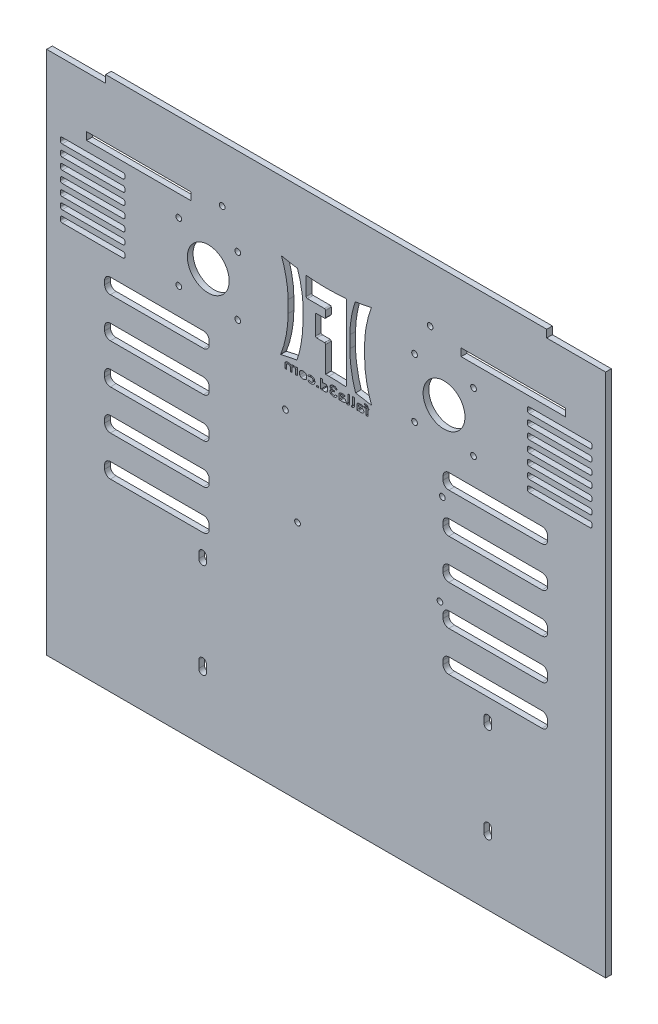
from build123d import *

# Parameters (mm, degrees)
SKETCH1_R           = 1.5
SKETCH1_W           = 0.92247458
SKETCH1_H           = 0.720885655
SKETCH1_R_2         = 11
SKETCH1_W_2         = 55
SKETCH1_H_2         = 4
BOSS_EXTRUDE1_DEPTH = 3


with BuildPart() as part:
    # Sketch1 → Boss-Extrude1 (new body)
    with BuildSketch(Plane.XY):
        Polygon((-147, -122), (147, -122), (147, 154), (116, 154), (116, 158), (-116, 158), (-116, 154), (-147, 154), align=None)
        with BuildLine():
            ThreePointArc((-63, -88), (-65, -90), (-67, -88))
            Line((-67, -88), (-67, -84.07834269))
            ThreePointArc((-67, -84.07834269), (-65, -82.07834269), (-63, -84.07834269))
            Line((-63, -84.07834269), (-63, -88))
        make_face(mode=Mode.SUBTRACT)
        with BuildLine():
            ThreePointArc((-64.5, -17), (-62.378679656, -17.878679656), (-61.5, -20))
            Line((-61.5, -20), (-61.5, -22))
            ThreePointArc((-61.5, -22), (-62.378679656, -24.121320344), (-64.5, -25))
            Line((-64.5, -25), (-113.5, -25))
            ThreePointArc((-113.5, -25), (-115.621320344, -24.121320344), (-116.5, -22))
            Line((-116.5, -22), (-116.5, -20))
            ThreePointArc((-116.5, -20), (-115.621320344, -17.878679656), (-113.5, -17))
            Line((-113.5, -17), (-64.5, -17))
        make_face(mode=Mode.SUBTRACT)
        with BuildLine():
            ThreePointArc((-64.5, 4), (-62.378679656, 3.121320344), (-61.5, 1))
            Line((-61.5, 1), (-61.5, -1))
            ThreePointArc((-61.5, -1), (-62.378679656, -3.121320344), (-64.5, -4))
            Line((-64.5, -4), (-113.5, -4))
            ThreePointArc((-113.5, -4), (-115.621320344, -3.121320344), (-116.5, -1))
            Line((-116.5, -1), (-116.5, 1))
            ThreePointArc((-116.5, 1), (-115.621320344, 3.121320344), (-113.5, 4))
            Line((-113.5, 4), (-64.5, 4))
        make_face(mode=Mode.SUBTRACT)
        with BuildLine():
            ThreePointArc((-63, -38), (-65, -40), (-67, -38))
            Line((-67, -38), (-67, -35.07834269))
            ThreePointArc((-67, -35.07834269), (-65, -33.07834269), (-63, -35.07834269))
            Line((-63, -35.07834269), (-63, -38))
        make_face(mode=Mode.SUBTRACT)
        with Locations((-15.065051974, 4.435129713)):
            Circle(SKETCH1_R, mode=Mode.SUBTRACT)
        with BuildLine():
            ThreePointArc((87, -88), (85, -90), (83, -88))
            Line((83, -88), (83, -84.07834269))
            ThreePointArc((83, -84.07834269), (85, -82.07834269), (87, -84.07834269))
            Line((87, -84.07834269), (87, -88))
        make_face(mode=Mode.SUBTRACT)
        with Locations((59.849932509, 5.935129713)):
            Circle(SKETCH1_R, mode=Mode.SUBTRACT)
        with BuildLine():
            ThreePointArc((87, -38), (85, -40), (83, -38))
            Line((83, -38), (83, -35.07834269))
            ThreePointArc((83, -35.07834269), (85, -33.07834269), (87, -35.07834269))
            Line((87, -35.07834269), (87, -38))
        make_face(mode=Mode.SUBTRACT)
        with BuildLine():
            Line((64.5, -17), (113.5, -17))
            ThreePointArc((113.5, -17), (115.621320344, -17.878679656), (116.5, -20))
            Line((116.5, -20), (116.5, -22))
            ThreePointArc((116.5, -22), (115.621320344, -24.121320344), (113.5, -25))
            Line((113.5, -25), (64.5, -25))
            ThreePointArc((64.5, -25), (62.378679656, -24.121320344), (61.5, -22))
            Line((61.5, -22), (61.5, -20))
            ThreePointArc((61.5, -20), (62.378679656, -17.878679656), (64.5, -17))
        make_face(mode=Mode.SUBTRACT)
        with BuildLine():
            Line((64.5, 4), (113.5, 4))
            ThreePointArc((113.5, 4), (115.621320344, 3.121320344), (116.5, 1))
            Line((116.5, 1), (116.5, -1))
            ThreePointArc((116.5, -1), (115.621320344, -3.121320344), (113.5, -4))
            Line((113.5, -4), (64.5, -4))
            ThreePointArc((64.5, -4), (62.378679656, -3.121320344), (61.5, -1))
            Line((61.5, -1), (61.5, 1))
            ThreePointArc((61.5, 1), (62.378679656, 3.121320344), (64.5, 4))
        make_face(mode=Mode.SUBTRACT)
        with BuildLine():
            ThreePointArc((-64.5, 25), (-62.378679656, 24.121320344), (-61.5, 22))
            Line((-61.5, 22), (-61.5, 20))
            ThreePointArc((-61.5, 20), (-62.378679656, 17.878679656), (-64.5, 17))
            Line((-64.5, 17), (-113.5, 17))
            ThreePointArc((-113.5, 17), (-115.621320344, 17.878679656), (-116.5, 20))
            Line((-116.5, 20), (-116.5, 22))
            ThreePointArc((-116.5, 22), (-115.621320344, 24.121320344), (-113.5, 25))
            Line((-113.5, 25), (-64.5, 25))
        make_face(mode=Mode.SUBTRACT)
        with BuildLine():
            ThreePointArc((-64.5, 46), (-62.378679656, 45.121320344), (-61.5, 43))
            Line((-61.5, 43), (-61.5, 41))
            ThreePointArc((-61.5, 41), (-62.378679656, 38.878679656), (-64.5, 38))
            Line((-64.5, 38), (-113.5, 38))
            ThreePointArc((-113.5, 38), (-115.621320344, 38.878679656), (-116.5, 41))
            Line((-116.5, 41), (-116.5, 43))
            ThreePointArc((-116.5, 43), (-115.621320344, 45.121320344), (-113.5, 46))
            Line((-113.5, 46), (-64.5, 46))
        make_face(mode=Mode.SUBTRACT)
        with BuildLine():
            ThreePointArc((-106.82550191, 82), (-106.118395129, 81.707106781), (-105.82550191, 81))
            Line((-105.82550191, 81), (-105.82550191, 80))
            ThreePointArc((-105.82550191, 80), (-106.118395129, 79.292893219), (-106.82550191, 79))
            Line((-106.82550191, 79), (-138.82550191, 79))
            ThreePointArc((-138.82550191, 79), (-139.532608691, 79.292893219), (-139.82550191, 80))
            Line((-139.82550191, 80), (-139.82550191, 81))
            ThreePointArc((-139.82550191, 81), (-139.532608691, 81.707106781), (-138.82550191, 82))
            Line((-138.82550191, 82), (-106.82550191, 82))
        make_face(mode=Mode.SUBTRACT)
        with BuildLine():
            ThreePointArc((-106.82550191, 88), (-106.118395129, 87.707106781), (-105.82550191, 87))
            Line((-105.82550191, 87), (-105.82550191, 86))
            ThreePointArc((-105.82550191, 86), (-106.118395129, 85.292893219), (-106.82550191, 85))
            Line((-106.82550191, 85), (-138.82550191, 85))
            ThreePointArc((-138.82550191, 85), (-139.532608691, 85.292893219), (-139.82550191, 86))
            Line((-139.82550191, 86), (-139.82550191, 87))
            ThreePointArc((-139.82550191, 87), (-139.532608691, 87.707106781), (-138.82550191, 88))
            Line((-138.82550191, 88), (-106.82550191, 88))
        make_face(mode=Mode.SUBTRACT)
        with BuildLine():
            ThreePointArc((-64.5, 67), (-62.378679656, 66.121320344), (-61.5, 64))
            Line((-61.5, 64), (-61.5, 62))
            ThreePointArc((-61.5, 62), (-62.378679656, 59.878679656), (-64.5, 59))
            Line((-64.5, 59), (-113.5, 59))
            ThreePointArc((-113.5, 59), (-115.621320344, 59.878679656), (-116.5, 62))
            Line((-116.5, 62), (-116.5, 64))
            ThreePointArc((-116.5, 64), (-115.621320344, 66.121320344), (-113.5, 67))
            Line((-113.5, 67), (-64.5, 67))
        make_face(mode=Mode.SUBTRACT)
        with Locations((-77.5, 81)):
            Circle(SKETCH1_R, mode=Mode.SUBTRACT)
        with Locations((-21.415051974, 52.695129713)):
            Circle(SKETCH1_R, mode=Mode.SUBTRACT)
        with Locations((-46.5, 81)):
            Circle(SKETCH1_R, mode=Mode.SUBTRACT)
        with BuildLine():
            Line((-15.097197603, 74.863458066), (-15.097197603, 71.264505587))
            Line((-15.097197603, 71.264505587), (-16.020593606, 71.264505587))
            Line((-16.020593606, 71.264505587), (-16.020593606, 73.40990721))
            add(Edge.make_bspline(
                [(-16.299727456, 73.986371111), (-16.113569226, 73.854425138), (-16.020593606, 73.662207781), (-16.020593606, 73.40990721)],
                knots=[22, 22, 22, 22, 23, 23, 23, 23], degree=3))
            add(Edge.make_bspline(
                [(-16.983505658, 74.187771246), (-16.704371808, 74.187771246), (-16.476326565, 74.120518692), (-16.299727456, 73.986371111)],
                knots=[21, 21, 21, 21, 22, 22, 22, 22], degree=3))
            add(Edge.make_bspline(
                [(-17.671875249, 73.986371111), (-17.491964319, 74.120518692), (-17.262451337, 74.187771246), (-16.983505658, 74.187771246)],
                knots=[20, 20, 20, 20, 21, 21, 21, 21], degree=3))
            add(Edge.make_bspline(
                [(-17.937046762, 73.40990721), (-17.937046762, 73.662207781), (-17.848474358, 73.854425138), (-17.671875249, 73.986371111)],
                knots=[19, 19, 19, 19, 20, 20, 20, 20], degree=3))
            Line((-17.937046762, 73.40990721), (-17.937046762, 71.264505587))
            Line((-17.937046762, 71.264505587), (-18.859520723, 71.264505587))
            Line((-18.859520723, 71.264505587), (-18.859520723, 73.40990721))
            add(Edge.make_bspline(
                [(-19.134063185, 73.986371111), (-18.951028604, 73.854425138), (-18.859520723, 73.662207781), (-18.859520723, 73.40990721)],
                knots=[15, 15, 15, 15, 16, 16, 16, 16], degree=3))
            add(Edge.make_bspline(
                [(-19.822432775, 74.187771245), (-19.543298925, 74.187771245), (-19.313955298, 74.120518692), (-19.134063185, 73.986371111)],
                knots=[14, 14, 14, 14, 15, 15, 15, 15], degree=3))
            add(Edge.make_bspline(
                [(-20.506210978, 73.986371111), (-20.329423697, 74.120518692), (-20.101566626, 74.187771245), (-19.822432775, 74.187771245)],
                knots=[13, 13, 13, 13, 14, 14, 14, 14], degree=3))
            add(Edge.make_bspline(
                [(-20.77138249, 73.40990721), (-20.77138249, 73.662207781), (-20.682979441, 73.854425138), (-20.506210978, 73.986371111)],
                knots=[12, 12, 12, 12, 13, 13, 13, 13], degree=3))
            Line((-20.77138249, 73.40990721), (-20.77138249, 71.264505587))
            Line((-20.77138249, 71.264505587), (-21.694778493, 71.264505587))
            Line((-21.694778493, 71.264505587), (-21.694778493, 73.656882522))
            add(Edge.make_bspline(
                [(-21.191814445, 74.592961295), (-21.515055734, 74.380364946), (-21.68264142, 74.068319871), (-21.694778493, 73.656882522)],
                knots=[8, 8, 8, 8, 9, 9, 9, 9], degree=3))
            add(Edge.make_bspline(
                [(-20.112951011, 74.908487546), (-20.506022806, 74.908487546), (-20.86582585, 74.803374853), (-21.191814445, 74.592961295)],
                knots=[7, 7, 7, 7, 8, 8, 8, 8], degree=3))
            add(Edge.make_bspline(
                [(-18.617870669, 74.436948166), (-18.989622613, 74.755955593), (-19.487995272, 74.913078934), (-20.112951011, 74.908487546)],
                knots=[6, 6, 6, 6, 7, 7, 7, 7], degree=3))
            add(Edge.make_bspline(
                [(-18.073753477, 74.780229738), (-18.271860608, 74.690170778), (-18.45322046, 74.575687136), (-18.617870669, 74.436948166)],
                knots=[5, 5, 5, 5, 6, 6, 6, 6], degree=3))
            add(Edge.make_bspline(
                [(-17.278257757, 74.908487546), (-17.607370002, 74.903896157), (-17.872541514, 74.861068286), (-18.073753477, 74.780229738)],
                knots=[4, 4, 4, 4, 5, 5, 5, 5], degree=3))
            add(Edge.make_bspline(
                [(-16.039147332, 74.482165818), (-16.353205844, 74.766436755), (-16.766110932, 74.908487546), (-17.278257757, 74.908487546)],
                knots=[3, 3, 3, 3, 4, 4, 4, 4], degree=3))
            Line((-16.039147332, 74.482165818), (-16.021515647, 74.482165818))
            Line((-16.021515647, 74.482165818), (-16.021515647, 74.863458066))
            Line((-16.021515647, 74.863458066), (-15.097197603, 74.863458066))
        make_face(mode=Mode.SUBTRACT)
        with BuildLine():
            add(Edge.make_bspline(
                [(-10.344207595, 73.942828187), (-10.264441627, 73.739019455), (-10.224568052, 73.447221652), (-10.224568052, 72.688287686), (-10.264441627, 72.399406543), (-10.344207595, 72.20058436)],
                knots=[0, 0, 0, 0, 1, 1, 1.998018429, 1.998018429, 1.998018429, 1.998018429], degree=3))
            add(Edge.make_bspline(
                [(-10.724765489, 71.684015501), (-10.553699106, 71.829566285), (-10.426720868, 72.00174336), (-10.344207595, 72.20058436)],
                knots=[15, 15, 15, 15, 16, 16, 16, 16], degree=3))
            add(Edge.make_bspline(
                [(-11.256030556, 71.37898923), (-11.028719182, 71.469029372), (-10.85174373, 71.570830244), (-10.724765489, 71.684015501)],
                knots=[14, 14, 14, 14, 15, 15, 15, 15], degree=3))
            add(Edge.make_bspline(
                [(-12.119155173, 71.222976101), (-11.767989209, 71.227567489), (-11.480218279, 71.279559321), (-11.256030556, 71.37898923)],
                knots=[13, 13, 13, 13, 14, 14, 14, 14], degree=3))
            add(Edge.make_bspline(
                [(-12.999930293, 71.37898923), (-12.775742569, 71.279559321), (-12.482081867, 71.227567489), (-12.119155173, 71.222976101)],
                knots=[12, 12, 12, 12, 13, 13, 13, 13], degree=3))
            add(Edge.make_bspline(
                [(-13.296507657, 71.528002372), (-13.219884154, 71.470120768), (-13.121018761, 71.420518716), (-12.999930293, 71.37898923)],
                knots=[11, 11, 11, 11, 12, 12, 12, 12], degree=3))
            add(Edge.make_bspline(
                [(-13.513544857, 71.684015501), (-13.454364868, 71.630913457), (-13.382144582, 71.578921625), (-13.296507657, 71.528002372)],
                knots=[10, 10, 10, 10, 11, 11, 11, 11], degree=3))
            add(Edge.make_bspline(
                [(-13.903116659, 72.20058436), (-13.826304984, 72.00174336), (-13.696372448, 71.829566285), (-13.513544857, 71.684015501)],
                knots=[9, 9, 9, 9, 10, 10, 10, 10], degree=3))
            add(Edge.make_bspline(
                [(-13.903286013, 73.941172277), (-13.976974038, 73.737739888), (-14.013742781, 73.446487782), (-14.013742781, 73.067378325), (-14.013742781, 72.688287686), (-13.976804683, 72.399406543), (-13.903116659, 72.20058436)],
                knots=[7, 7, 7, 7, 8, 8, 8, 9, 9, 9, 9], degree=3))
            add(Edge.make_bspline(
                [(-13.514824425, 74.443929335), (-13.69729449, 74.307580146), (-13.82666251, 74.139994459), (-13.903286013, 73.941172277)],
                knots=[6, 6, 6, 6, 7, 7, 7, 7], degree=3))
            add(Edge.make_bspline(
                [(-13.001209861, 74.766436755), (-13.222650278, 74.671617052), (-13.39371714, 74.564114579), (-13.514824425, 74.443929335)],
                knots=[5, 5, 5, 5, 6, 6, 6, 6], degree=3))
            add(Edge.make_bspline(
                [(-12.119889043, 74.908487546), (-12.483003908, 74.903896157), (-12.776833965, 74.856476897), (-13.001209861, 74.766436755)],
                knots=[4, 4, 4, 4, 5, 5, 5, 5], degree=3))
            add(Edge.make_bspline(
                [(-11.256388082, 74.767170624), (-11.480763977, 74.856853241), (-11.768723079, 74.903896157), (-12.119889043, 74.908487546)],
                knots=[3, 3, 3, 3, 4, 4, 4, 4], degree=3))
            add(Edge.make_bspline(
                [(-10.724953661, 74.446319116), (-10.851931902, 74.565958661), (-11.029076709, 74.672896619), (-11.256388082, 74.767170624)],
                knots=[2, 2, 2, 2, 3, 3, 3, 3], degree=3))
            add(Edge.make_bspline(
                [(-10.344207595, 73.942828187), (-10.426890223, 74.141838542), (-10.55386846, 74.309800572), (-10.724953661, 74.446319116)],
                knots=[1, 1, 1, 1, 2, 2, 2, 2], degree=3))
        make_face(mode=Mode.SUBTRACT)
        with BuildLine():
            Line((-9.680450875, 71.843716795), (-8.998159246, 72.319471219))
            add(Edge.make_bspline(
                [(-8.063905762, 71.943673584), (-8.453477553, 71.948264973), (-8.764958105, 72.07360612), (-8.998159246, 72.319471219)],
                knots=[12, 12, 12, 12, 13, 13, 13, 13], degree=3))
            add(Edge.make_bspline(
                [(-6.868168936, 73.060585329), (-6.880117837, 72.304398669), (-7.278514879, 71.932101027), (-8.063905762, 71.943673584)],
                knots=[11, 11, 11, 11, 12, 12, 12, 12], degree=3))
            add(Edge.make_bspline(
                [(-8.063905762, 74.187771246), (-7.278703051, 74.196954023), (-6.880117837, 73.821175205), (-6.868168936, 73.060585329)],
                knots=[10, 10, 10, 10, 11, 11, 11, 11], degree=3))
            add(Edge.make_bspline(
                [(-8.9983286, 73.808492435), (-8.765146277, 74.051967754), (-8.453665725, 74.178400297), (-8.063905762, 74.187771246)],
                knots=[9, 9, 9, 9, 10, 10, 10, 10], degree=3))
            Line((-8.9983286, 73.808492435), (-9.680450875, 74.282402777))
            add(Edge.make_bspline(
                [(-8.972416844, 74.735557785), (-9.243836168, 74.622560699), (-9.479784614, 74.471496485), (-9.680450875, 74.282402777)],
                knots=[7, 7, 7, 7, 8, 8, 8, 8], degree=3))
            add(Edge.make_bspline(
                [(-8.029733788, 74.908487546), (-8.386770699, 74.903896158), (-8.700829203, 74.846183907), (-8.972416844, 74.735557785)],
                knots=[6, 6, 6, 6, 7, 7, 7, 7], degree=3))
            add(Edge.make_bspline(
                [(-6.600607651, 74.482165818), (-7.010596067, 74.771028144), (-7.48708435, 74.913078935), (-8.029733788, 74.908487546)],
                knots=[5, 5, 5, 5, 6, 6, 6, 6], degree=3))
            add(Edge.make_bspline(
                [(-5.945694999, 73.060585329), (-5.957455727, 73.714594773), (-6.175753672, 74.188505115), (-6.600607651, 74.482165818)],
                knots=[4, 4, 4, 4, 5, 5, 5, 5], degree=3))
            add(Edge.make_bspline(
                [(-6.599873781, 71.656278998), (-6.175584318, 71.945141323), (-5.957455727, 72.413368881), (-5.945694999, 73.060585329)],
                knots=[3, 3, 3, 3, 4, 4, 4, 4], degree=3))
            add(Edge.make_bspline(
                [(-8.028077877, 71.222976101), (-7.485785965, 71.222976101), (-7.009674026, 71.367397855), (-6.599873781, 71.656278998)],
                knots=[2, 2, 2, 2, 3, 3, 3, 3], degree=3))
            add(Edge.make_bspline(
                [(-8.971514138, 71.405634338), (-8.699907162, 71.288384572), (-8.38530296, 71.22756749), (-8.028077877, 71.222976101)],
                knots=[1, 1, 1, 1, 2, 2, 2, 2], degree=3))
            add(Edge.make_bspline(
                [(-9.680450875, 71.843716795), (-9.47961526, 71.664370379), (-9.24329047, 71.518273897), (-8.971514138, 71.405634338)],
                knots=[0, 0, 0, 0, 1, 1, 1, 1], degree=3))
        make_face(mode=Mode.SUBTRACT)
        with Locations((-4.541755317, 71.624948416)):
            Rectangle(SKETCH1_W, SKETCH1_H, mode=Mode.SUBTRACT)
        with BuildLine():
            Line((-1.94089397, 71.640284406), (-1.94089397, 71.264505588))
            Line((-1.94089397, 71.264505588), (-2.86355608, 71.264505588))
            Line((-2.86355608, 71.264505588), (-2.86355608, 76.319775046))
            Line((-2.86355608, 76.319775046), (-1.940893971, 76.319775046))
            Line((-1.940893971, 76.319775046), (-1.940893971, 74.484367427))
            add(Edge.make_bspline(
                [(-1.405489141, 74.794737774), (-1.591365109, 74.714256752), (-1.769808296, 74.61079997), (-1.940893971, 74.484367427)],
                knots=[9, 9, 9, 9, 10, 10, 10, 10], degree=3))
            add(Edge.make_bspline(
                [(-0.750670575, 74.908487547), (-0.986713108, 74.908487547), (-1.204916967, 74.870627407), (-1.405489141, 74.794737774)],
                knots=[8, 8, 8, 8, 9, 9, 9, 9], degree=3))
            add(Edge.make_bspline(
                [(0.479257799, 74.439526119), (0.219693051, 74.740713689), (-0.190276549, 74.897084344), (-0.750670575, 74.908487547)],
                knots=[7, 7, 7, 7, 8, 8, 8, 8], degree=3))
            add(Edge.make_bspline(
                [(0.73146352, 73.991884541), (0.690122206, 74.176932558), (0.606141193, 74.32615269), (0.479257799, 74.439526119)],
                knots=[6, 6, 6, 6, 7, 7, 7, 7], degree=3))
            add(Edge.make_bspline(
                [(0.73146352, 73.991884541), (0.781535999, 73.809038133), (0.806619282, 73.501433909), (0.806619282, 72.643258207), (0.781535999, 72.337855592), (0.73146352, 72.152807575)],
                knots=[5, 5, 5, 5, 6, 6, 6.983818348, 6.983818348, 6.983818348, 6.983818348], degree=3))
            add(Edge.make_bspline(
                [(0.479257799, 71.691373014), (0.606141193, 71.80476526), (0.690122206, 71.958557963), (0.73146352, 72.152807575)],
                knots=[3, 3, 3, 3, 4, 4, 4, 4], degree=3))
            add(Edge.make_bspline(
                [(-0.038402456, 71.358215078), (0.168058747, 71.441462223), (0.340593344, 71.552634044), (0.479257799, 71.691373014)],
                knots=[2, 2, 2, 2, 3, 3, 3, 3], degree=3))
            add(Edge.make_bspline(
                [(-0.750670575, 71.222976101), (-0.473361997, 71.22756749), (-0.235945811, 71.272578153), (-0.038402456, 71.358215078)],
                knots=[1, 1, 1, 1, 2, 2, 2, 2], degree=3))
            add(Edge.make_bspline(
                [(-1.94089397, 71.640284406), (-1.637034371, 71.37108602), (-1.240293239, 71.232158879), (-0.750670575, 71.222976101)],
                knots=[0, 0, 0, 0, 1, 1, 1, 1], degree=3))
        make_face(mode=Mode.SUBTRACT)
        with BuildLine():
            ThreePointArc((-106.82550191, 94), (-106.118395129, 93.707106781), (-105.82550191, 93))
            Line((-105.82550191, 93), (-105.82550191, 92))
            ThreePointArc((-105.82550191, 92), (-106.118395129, 91.292893219), (-106.82550191, 91))
            Line((-106.82550191, 91), (-138.82550191, 91))
            ThreePointArc((-138.82550191, 91), (-139.532608691, 91.292893219), (-139.82550191, 92))
            Line((-139.82550191, 92), (-139.82550191, 93))
            ThreePointArc((-139.82550191, 93), (-139.532608691, 93.707106781), (-138.82550191, 94))
            Line((-138.82550191, 94), (-106.82550191, 94))
        make_face(mode=Mode.SUBTRACT)
        with BuildLine():
            ThreePointArc((-106.82550191, 100), (-106.118395129, 99.707106781), (-105.82550191, 99))
            Line((-105.82550191, 99), (-105.82550191, 98))
            ThreePointArc((-105.82550191, 98), (-106.118395129, 97.292893219), (-106.82550191, 97))
            Line((-106.82550191, 97), (-138.82550191, 97))
            ThreePointArc((-138.82550191, 97), (-139.532608691, 97.292893219), (-139.82550191, 98))
            Line((-139.82550191, 98), (-139.82550191, 99))
            ThreePointArc((-139.82550191, 99), (-139.532608691, 99.707106781), (-138.82550191, 100))
            Line((-138.82550191, 100), (-106.82550191, 100))
        make_face(mode=Mode.SUBTRACT)
        with BuildLine():
            ThreePointArc((-106.82550191, 106), (-106.118395129, 105.707106781), (-105.82550191, 105))
            Line((-105.82550191, 105), (-105.82550191, 104))
            ThreePointArc((-105.82550191, 104), (-106.118395129, 103.292893219), (-106.82550191, 103))
            Line((-106.82550191, 103), (-138.82550191, 103))
            ThreePointArc((-138.82550191, 103), (-139.532608691, 103.292893219), (-139.82550191, 104))
            Line((-139.82550191, 104), (-139.82550191, 105))
            ThreePointArc((-139.82550191, 105), (-139.532608691, 105.707106781), (-138.82550191, 106))
            Line((-138.82550191, 106), (-106.82550191, 106))
        make_face(mode=Mode.SUBTRACT)
        with BuildLine():
            ThreePointArc((-106.82550191, 112), (-106.118395129, 111.707106781), (-105.82550191, 111))
            Line((-105.82550191, 111), (-105.82550191, 110))
            ThreePointArc((-105.82550191, 110), (-106.118395129, 109.292893219), (-106.82550191, 109))
            Line((-106.82550191, 109), (-138.82550191, 109))
            ThreePointArc((-138.82550191, 109), (-139.532608691, 109.292893219), (-139.82550191, 110))
            Line((-139.82550191, 110), (-139.82550191, 111))
            ThreePointArc((-139.82550191, 111), (-139.532608691, 111.707106781), (-138.82550191, 112))
            Line((-138.82550191, 112), (-106.82550191, 112))
        make_face(mode=Mode.SUBTRACT)
        with BuildLine():
            ThreePointArc((-106.82550191, 118), (-106.118395129, 117.707106781), (-105.82550191, 117))
            Line((-105.82550191, 117), (-105.82550191, 116))
            ThreePointArc((-105.82550191, 116), (-106.118395129, 115.292893219), (-106.82550191, 115))
            Line((-106.82550191, 115), (-138.82550191, 115))
            ThreePointArc((-138.82550191, 115), (-139.532608691, 115.292893219), (-139.82550191, 116))
            Line((-139.82550191, 116), (-139.82550191, 117))
            ThreePointArc((-139.82550191, 117), (-139.532608691, 117.707106781), (-138.82550191, 118))
            Line((-138.82550191, 118), (-106.82550191, 118))
        make_face(mode=Mode.SUBTRACT)
        with Locations((-77.5, 112)):
            Circle(SKETCH1_R, mode=Mode.SUBTRACT)
        with Locations((-62, 96.5)):
            Circle(SKETCH1_R_2, mode=Mode.SUBTRACT)
        with Locations((-46.5, 112)):
            Circle(SKETCH1_R, mode=Mode.SUBTRACT)
        with BuildLine():
            add(Edge.make_bspline(
                [(-15.063006814, 120.154007258), (-13.677799907, 116.421942143), (-12.179802903, 109.562614466), (-12.179802903, 103.684075149)],
                knots=[4, 4, 4, 4, 5, 5, 5, 5], degree=3))
            Line((-12.179802903, 103.684075149), (-12.179802903, 97.308348655))
            add(Edge.make_bspline(
                [(-12.179802903, 97.308348655), (-12.179802902, 90.001341765), (-13.938078955, 81.93891972), (-15.33803852, 78.273730815)],
                knots=[6, 6, 6, 6, 7, 7, 7, 7], degree=3))
            add(Edge.make_bspline(
                [(-15.33803852, 78.273730815), (-18.247040766, 77.799594666), (-21.116940939, 77.207587786), (-23.939459487, 76.497352647)],
                knots=[7, 7, 7, 7, 8, 8, 8, 8], degree=3))
            add(Edge.make_bspline(
                [(-23.939459487, 76.497352647), (-23.939459487, 76.593132025), (-23.936730998, 76.651126533), (-23.885792928, 76.754282241)],
                knots=[8, 8, 8, 8, 9, 9, 9, 9], degree=3))
            add(Edge.make_bspline(
                [(-23.885792928, 76.754282241), (-21.852315813, 81.480495905), (-19.983357186, 89.614987699), (-19.983357186, 97.143359737)],
                knots=[0, 0, 0, 0, 1, 1, 1, 1], degree=3))
            Line((-19.983357186, 97.143359737), (-19.983357186, 103.519086231))
            add(Edge.make_bspline(
                [(-19.983357186, 103.519086231), (-19.983357186, 109.22008558), (-21.52764442, 116.608457899), (-23.571677966, 121.762423396)],
                knots=[2, 2, 2, 2, 3, 3, 3, 3], degree=3))
            add(Edge.make_bspline(
                [(-23.571677966, 121.762423396), (-20.777535706, 121.110991903), (-17.938363966, 120.575342437), (-15.063006814, 120.154007258)],
                knots=[3, 3, 3, 3, 4, 4, 4, 4], degree=3))
        make_face(mode=Mode.SUBTRACT)
        with BuildLine():
            Line((4.310131002, 74.187037377), (4.310131002, 73.549756394))
            Line((4.310131002, 73.549756394), (3.914951695, 73.549756394))
            add(Edge.make_bspline(
                [(3.206447754, 73.344668094), (3.392511893, 73.481393627), (3.628648512, 73.549756394), (3.914951695, 73.549756394)],
                knots=[26, 26, 26, 26, 27, 27, 27, 27], degree=3))
            add(Edge.make_bspline(
                [(2.914273615, 72.746714989), (2.92014457, 73.003983292), (3.017542223, 73.203181818), (3.206447754, 73.344668094)],
                knots=[25, 25, 25, 25, 26, 26, 26, 26], degree=3))
            add(Edge.make_bspline(
                [(3.20654184, 72.162724222), (3.017542223, 72.299449755), (2.92014457, 72.494038075), (2.914273615, 72.746714989)],
                knots=[24, 24, 24, 24, 25, 25, 25, 25], degree=3))
            add(Edge.make_bspline(
                [(3.893086148, 71.943673585), (3.621479171, 71.943673585), (3.392605979, 72.01662774), (3.20654184, 72.162724222)],
                knots=[23, 23, 23, 23, 24, 24, 24, 24], degree=3))
            add(Edge.make_bspline(
                [(4.504267706, 72.107232397), (4.350832533, 71.998262185), (4.147042623, 71.943673585), (3.893086148, 71.943673585)],
                knots=[22, 22, 22, 22, 23, 23, 23, 23], degree=3))
            add(Edge.make_bspline(
                [(4.854249048, 72.517390179), (4.771641686, 72.348129765), (4.654955573, 72.211423049), (4.504267706, 72.107232397)],
                knots=[21, 21, 21, 21, 22, 22, 22, 22], degree=3))
            Line((4.854249048, 72.517390179), (5.779939853, 72.517390179))
            add(Edge.make_bspline(
                [(5.120511956, 71.555211996), (5.459822222, 71.776633596), (5.679606723, 72.097296933), (5.779939853, 72.517390179)],
                knots=[19, 19, 19, 19, 20, 20, 20, 20], degree=3))
            add(Edge.make_bspline(
                [(3.952154078, 71.222976101), (4.391797504, 71.222976102), (4.781294027, 71.333583407), (5.120511956, 71.555211996)],
                knots=[18, 18, 18, 18, 19, 19, 19, 19], degree=3))
            add(Edge.make_bspline(
                [(2.553642625, 71.649297829), (2.916569309, 71.369618281), (3.382764601, 71.22756749), (3.952154078, 71.222976101)],
                knots=[17, 17, 17, 17, 18, 18, 18, 18], degree=3))
            add(Edge.make_bspline(
                [(1.991611505, 72.769314406), (1.997576547, 72.295404064), (2.184920253, 71.921996209), (2.553642625, 71.649297829)],
                knots=[16, 16, 16, 16, 17, 17, 17, 17], degree=3))
            add(Edge.make_bspline(
                [(2.169941789, 73.379404584), (2.05105573, 73.185361961), (1.991611505, 72.981929572), (1.991611505, 72.769314406)],
                knots=[15, 15, 15, 15, 16, 16, 16, 16], degree=3))
            add(Edge.make_bspline(
                [(2.777924428, 73.878680467), (2.497587095, 73.740129669), (2.29490659, 73.573635378), (2.169941789, 73.379404584)],
                knots=[14, 14, 14, 14, 15, 15, 15, 15], degree=3))
            add(Edge.make_bspline(
                [(2.20652236, 74.360701008), (2.313196875, 74.180432551), (2.503664231, 74.019809217), (2.777924428, 73.878680467)],
                knots=[13, 13, 13, 13, 14, 14, 14, 14], degree=3))
            add(Edge.make_bspline(
                [(2.069345218, 74.922449884), (2.069345218, 74.72821909), (2.115089749, 74.540969465), (2.20652236, 74.360701008)],
                knots=[12, 12, 12, 12, 13, 13, 13, 13], degree=3))
            add(Edge.make_bspline(
                [(2.574228604, 75.921020468), (2.243535726, 75.638932322), (2.075216174, 75.30615073), (2.069345218, 74.922449884)],
                knots=[11, 11, 11, 11, 12, 12, 12, 12], degree=3))
            add(Edge.make_bspline(
                [(3.973849425, 76.361304533), (3.386264594, 76.356713145), (2.919692958, 76.209882793), (2.574228604, 75.921020468)],
                knots=[10, 10, 10, 10, 11, 11, 11, 11], degree=3))
            add(Edge.make_bspline(
                [(5.169661519, 75.973200471), (4.83605198, 76.227345124), (4.437466766, 76.356713145), (3.973849425, 76.361304533)],
                knots=[9, 9, 9, 9, 10, 10, 10, 10], degree=3))
            add(Edge.make_bspline(
                [(5.749888839, 75.02701688), (5.702676569, 75.401327959), (5.509254917, 75.716666038), (5.169661519, 75.973200471)],
                knots=[8, 8, 8, 8, 9, 9, 9, 9], degree=3))
            Line((5.749888839, 75.02701688), (4.823463296, 75.02701688))
            add(Edge.make_bspline(
                [(4.477717543, 75.490634232), (4.649159885, 75.390677443), (4.764377394, 75.236132053), (4.823463296, 75.02701688)],
                knots=[6, 6, 6, 6, 7, 7, 7, 7], degree=3))
            add(Edge.make_bspline(
                [(3.936912173, 75.640400061), (4.134905551, 75.640400061), (4.315174003, 75.590421667), (4.477717543, 75.490634232)],
                knots=[5, 5, 5, 5, 6, 6, 6, 6], degree=3))
            add(Edge.make_bspline(
                [(3.263143876, 75.434784881), (3.437541372, 75.567276552), (3.662086616, 75.635808673), (3.936912173, 75.640400061)],
                knots=[4, 4, 4, 4, 5, 5, 5, 5], degree=3))
            add(Edge.make_bspline(
                [(2.992835283, 74.908487547), (2.998706239, 75.122194109), (3.088840465, 75.297701822), (3.263143876, 75.434784881)],
                knots=[3, 3, 3, 3, 4, 4, 4, 4], degree=3))
            add(Edge.make_bspline(
                [(3.25460171, 74.392671374), (3.0801093, 74.525163045), (2.992835283, 74.696982593), (2.992835283, 74.908487547)],
                knots=[2, 2, 2, 2, 3, 3, 3, 3], degree=3))
            add(Edge.make_bspline(
                [(3.991198853, 74.187037377), (3.6746753, 74.187037377), (3.429167733, 74.255588315), (3.25460171, 74.392671374)],
                knots=[1, 1, 1, 1, 2, 2, 2, 2], degree=3))
            Line((3.991198853, 74.187037377), (4.310131002, 74.187037377))
        make_face(mode=Mode.SUBTRACT)
        with BuildLine():
            Line((7.568116339, 71.583324843), (7.568116339, 71.264505588))
            Line((7.568116339, 71.264505588), (6.645548315, 71.264505588))
            Line((6.645548315, 71.264505588), (6.645548315, 73.722667338))
            add(Edge.make_bspline(
                [(7.171939722, 74.651953114), (6.82692698, 74.471684657), (6.651419271, 74.161860008), (6.645548315, 73.722667338)],
                knots=[15, 15, 15, 15, 16, 16, 16, 16], degree=3))
            add(Edge.make_bspline(
                [(8.556751433, 74.908487547), (7.978744539, 74.913078936), (7.517121818, 74.827630182), (7.171939722, 74.651953114)],
                knots=[14, 14, 14, 14, 15, 15, 15, 15], degree=3))
            add(Edge.make_bspline(
                [(10.109638072, 74.384391821), (9.758735557, 74.743103469), (9.241095112, 74.917670324), (8.556751433, 74.908487547)],
                knots=[13, 13, 13, 13, 14, 14, 14, 14], degree=3))
            Line((10.109638072, 74.384391821), (9.383502447, 73.950543227))
            add(Edge.make_bspline(
                [(9.055857949, 74.173620737), (9.194596915, 74.129343944), (9.303849382, 74.055091405), (9.383502447, 73.950543227)],
                knots=[11, 11, 11, 11, 12, 12, 12, 12], degree=3))
            add(Edge.make_bspline(
                [(8.511270342, 74.229300733), (8.741536005, 74.229300733), (8.922989938, 74.210747007), (9.055857949, 74.173620737)],
                knots=[10, 10, 10, 10, 11, 11, 11, 11], degree=3))
            add(Edge.make_bspline(
                [(7.568116339, 73.765852736), (7.562057211, 74.084126293), (7.876379155, 74.238483511), (8.511270342, 74.229300733)],
                knots=[9, 9, 9, 9, 10, 10, 10, 10], degree=3))
            Line((7.568116339, 73.765852736), (7.568116339, 73.386028227))
            Line((7.568116339, 73.386028227), (8.847194393, 73.386028227))
            add(Edge.make_bspline(
                [(9.962525467, 73.074171324), (9.708757164, 73.277415541), (9.337005229, 73.381436838), (8.847194393, 73.386028227)],
                knots=[6, 6, 6, 6, 7, 7, 7, 7], degree=3))
            add(Edge.make_bspline(
                [(10.343102653, 72.321861), (10.343102653, 72.624516309), (10.216218502, 72.875349141), (9.962525467, 73.074171324)],
                knots=[5, 5, 5, 5, 6, 6, 6, 6], degree=3))
            add(Edge.make_bspline(
                [(9.904926122, 71.541795356), (10.197100261, 71.745208928), (10.343102653, 72.005243354), (10.343102653, 72.321861)],
                knots=[4, 4, 4, 4, 5, 5, 5, 5], degree=3))
            add(Edge.make_bspline(
                [(8.718842503, 71.222976102), (9.232268882, 71.22756749), (9.627636361, 71.333771579), (9.904926122, 71.541795356)],
                knots=[3, 3, 3, 3, 4, 4, 4, 4], degree=3))
            add(Edge.make_bspline(
                [(7.984163883, 71.313016244), (8.1612146, 71.252914214), (8.406082383, 71.222976102), (8.718842503, 71.222976102)],
                knots=[2, 2, 2, 2, 3, 3, 3, 3], degree=3))
            add(Edge.make_bspline(
                [(7.585860926, 71.583324843), (7.671403764, 71.460937991), (7.804158871, 71.370709677), (7.984163883, 71.313016244)],
                knots=[1, 1, 1, 1, 2, 2, 2, 2], degree=3))
            Line((7.585860926, 71.583324843), (7.568116339, 71.583324843))
        make_face(mode=Mode.SUBTRACT)
        with BuildLine():
            Line((12.395716775, 76.319775047), (12.395716775, 72.134799547))
            add(Edge.make_bspline(
                [(12.050609948, 71.461314335), (12.280781524, 71.594897401), (12.395716775, 71.819273296), (12.395716775, 72.134799547)],
                knots=[7, 7, 7, 7, 8, 8, 8, 8], degree=3))
            add(Edge.make_bspline(
                [(11.218627762, 71.264505589), (11.555003425, 71.264505589), (11.832312003, 71.330102232), (12.050609948, 71.461314335)],
                knots=[6, 6, 6, 6, 7, 7, 7, 7], degree=3))
            Line((11.218627762, 71.264505589), (10.807096337, 71.264505589))
            Line((10.807096337, 71.264505589), (10.807096337, 71.943673585))
            Line((10.807096337, 71.943673585), (11.126837625, 71.943673585))
            add(Edge.make_bspline(
                [(11.473148752, 72.1901032), (11.473148752, 72.025829335), (11.357743071, 71.943673585), (11.126837625, 71.943673585)],
                knots=[2, 2, 2, 2, 3, 3, 3, 3], degree=3))
            Line((11.473148752, 72.1901032), (11.473148752, 76.319775047))
            Line((11.473148752, 76.319775047), (12.395716775, 76.319775047))
        make_face(mode=Mode.SUBTRACT)
        with BuildLine():
            Line((14.809507585, 76.319775047), (14.809507585, 72.134799547))
            add(Edge.make_bspline(
                [(14.464419575, 71.461314335), (14.694572334, 71.594897401), (14.809507585, 71.819273296), (14.809507585, 72.134799547)],
                knots=[7, 7, 7, 7, 8, 8, 8, 8], degree=3))
            add(Edge.make_bspline(
                [(13.632437389, 71.264505589), (13.968813052, 71.264505589), (14.246102812, 71.330102232), (14.464419575, 71.461314335)],
                knots=[6, 6, 6, 6, 7, 7, 7, 7], degree=3))
            Line((13.632437389, 71.264505589), (13.220905964, 71.264505589))
            Line((13.220905964, 71.264505589), (13.220905964, 71.943673585))
            Line((13.220905964, 71.943673585), (13.540647252, 71.943673585))
            add(Edge.make_bspline(
                [(13.886939561, 72.1901032), (13.886939561, 72.025829335), (13.771533881, 71.943673585), (13.540647252, 71.943673585)],
                knots=[2, 2, 2, 2, 3, 3, 3, 3], degree=3))
            Line((13.886939561, 72.1901032), (13.886939561, 76.319775047))
            Line((13.886939561, 76.319775047), (14.809507585, 76.319775047))
        make_face(mode=Mode.SUBTRACT)
        with BuildLine():
            Line((17.077127825, 71.583324844), (17.077127825, 71.264505589))
            Line((17.077127825, 71.264505589), (16.154558624, 71.264505589))
            Line((16.154558624, 71.264505589), (16.154558624, 73.722667339))
            add(Edge.make_bspline(
                [(16.680950031, 74.651953114), (16.335937289, 74.471684658), (16.16042958, 74.161860008), (16.154558624, 73.722667339)],
                knots=[15, 15, 15, 15, 16, 16, 16, 16], degree=3))
            add(Edge.make_bspline(
                [(18.065761742, 74.908487547), (17.487736031, 74.913078936), (17.026133303, 74.827630182), (16.680950031, 74.651953114)],
                knots=[14, 14, 14, 14, 15, 15, 15, 15], degree=3))
            add(Edge.make_bspline(
                [(19.618648382, 74.384391822), (19.267745867, 74.74310347), (18.750085625, 74.917670325), (18.065761742, 74.908487547)],
                knots=[13, 13, 13, 13, 14, 14, 14, 14], degree=3))
            Line((19.618648382, 74.384391822), (18.892512756, 73.950543227))
            add(Edge.make_bspline(
                [(18.564868258, 74.173620738), (18.703607224, 74.129343945), (18.812840874, 74.055091405), (18.892512756, 73.950543227)],
                knots=[11, 11, 11, 11, 12, 12, 12, 12], degree=3))
            add(Edge.make_bspline(
                [(18.020280652, 74.229300734), (18.250546314, 74.229300734), (18.432000248, 74.210747008), (18.564868258, 74.173620738)],
                knots=[10, 10, 10, 10, 11, 11, 11, 11], degree=3))
            add(Edge.make_bspline(
                [(17.077127825, 73.765852736), (17.07106752, 74.084126293), (17.385389464, 74.238483511), (18.020280652, 74.229300734)],
                knots=[9, 9, 9, 9, 10, 10, 10, 10], degree=3))
            Line((17.077127825, 73.765852736), (17.077127825, 73.386028227))
            Line((17.077127825, 73.386028227), (18.356204702, 73.386028227))
            add(Edge.make_bspline(
                [(19.471535777, 73.074171324), (19.217768704, 73.277415541), (18.846015538, 73.381436838), (18.356204702, 73.386028227)],
                knots=[6, 6, 6, 6, 7, 7, 7, 7], degree=3))
            add(Edge.make_bspline(
                [(19.471535777, 73.074171324), (19.725228811, 72.875349141), (19.852112963, 72.624516309), (19.852112963, 72.005243355), (19.70611057, 71.745208929), (19.413936431, 71.541795357)],
                knots=[5, 5, 5, 5, 6, 6, 7.046132803, 7.046132803, 7.046132803, 7.046132803], degree=3))
            add(Edge.make_bspline(
                [(18.227852812, 71.222976102), (18.741279191, 71.227567491), (19.136627853, 71.333771579), (19.413936431, 71.541795357)],
                knots=[3, 3, 3, 3, 4, 4, 4, 4], degree=3))
            add(Edge.make_bspline(
                [(17.49317538, 71.313016245), (17.670224909, 71.252914214), (17.915073875, 71.222976102), (18.227852812, 71.222976102)],
                knots=[2, 2, 2, 2, 3, 3, 3, 3], degree=3))
            add(Edge.make_bspline(
                [(17.094871236, 71.583324844), (17.180395256, 71.460937992), (17.313169181, 71.370709678), (17.49317538, 71.313016245)],
                knots=[1, 1, 1, 1, 2, 2, 2, 2], degree=3))
            Line((17.094871236, 71.583324844), (17.077127825, 71.583324844))
        make_face(mode=Mode.SUBTRACT)
        with BuildLine():
            Line((21.945881527, 74.309047886), (21.945881527, 71.264505589))
            Line((21.945881527, 71.264505589), (21.023312203, 71.264505589))
            Line((21.023312203, 71.264505589), (21.023312203, 74.309047886))
            Line((21.023312203, 74.309047886), (20.096058705, 74.309047886))
            Line((20.096058705, 74.309047886), (20.096058705, 74.863458068))
            Line((20.096058705, 74.863458068), (21.023312203, 74.863458068))
            Line((21.023312203, 74.863458068), (21.023312203, 75.340868403))
            add(Edge.make_bspline(
                [(20.62399312, 75.640400062), (20.902393093, 75.647381231), (21.035543361, 75.547424442), (21.023312203, 75.340868403)],
                knots=[9, 9, 9, 9, 10, 10, 10, 10], degree=3))
            Line((20.62399312, 75.640400062), (20.096058705, 75.640400062))
            Line((20.096058705, 75.640400062), (20.096058705, 76.319775047))
            Line((20.096058705, 76.319775047), (20.693466097, 76.319775047))
            add(Edge.make_bspline(
                [(21.583047629, 76.094288939), (21.347005096, 76.244619284), (21.050503008, 76.319775047), (20.693466097, 76.319775047)],
                knots=[5, 5, 5, 5, 6, 6, 6, 6], degree=3))
            add(Edge.make_bspline(
                [(21.945881527, 75.338478623), (21.945881527, 75.68046181), (21.824979934, 75.932593026), (21.583047629, 76.094288939)],
                knots=[4, 4, 4, 4, 5, 5, 5, 5], degree=3))
            Line((21.945881527, 75.338478623), (21.945881527, 74.863458068))
            Line((21.945881527, 74.863458068), (22.412000251, 74.863458068))
            Line((22.412000251, 74.863458068), (22.412000251, 74.309047886))
            Line((22.412000251, 74.309047886), (21.945881527, 74.309047886))
        make_face(mode=Mode.SUBTRACT)
        with Locations((61.121318797, 54.195129713)):
            Circle(SKETCH1_R, mode=Mode.SUBTRACT)
        with Locations((46.5, 81)):
            Circle(SKETCH1_R, mode=Mode.SUBTRACT)
        with BuildLine():
            Line((64.5, 25), (113.5, 25))
            ThreePointArc((113.5, 25), (115.621320344, 24.121320344), (116.5, 22))
            Line((116.5, 22), (116.5, 20))
            ThreePointArc((116.5, 20), (115.621320344, 17.878679656), (113.5, 17))
            Line((113.5, 17), (64.5, 17))
            ThreePointArc((64.5, 17), (62.378679656, 17.878679656), (61.5, 20))
            Line((61.5, 20), (61.5, 22))
            ThreePointArc((61.5, 22), (62.378679656, 24.121320344), (64.5, 25))
        make_face(mode=Mode.SUBTRACT)
        with BuildLine():
            Line((64.5, 46), (113.5, 46))
            ThreePointArc((113.5, 46), (115.621320344, 45.121320344), (116.5, 43))
            Line((116.5, 43), (116.5, 41))
            ThreePointArc((116.5, 41), (115.621320344, 38.878679656), (113.5, 38))
            Line((113.5, 38), (64.5, 38))
            ThreePointArc((64.5, 38), (62.378679656, 38.878679656), (61.5, 41))
            Line((61.5, 41), (61.5, 43))
            ThreePointArc((61.5, 43), (62.378679656, 45.121320344), (64.5, 46))
        make_face(mode=Mode.SUBTRACT)
        with BuildLine():
            Line((64.5, 67), (113.5, 67))
            ThreePointArc((113.5, 67), (115.621320344, 66.121320344), (116.5, 64))
            Line((116.5, 64), (116.5, 62))
            ThreePointArc((116.5, 62), (115.621320344, 59.878679656), (113.5, 59))
            Line((113.5, 59), (64.5, 59))
            ThreePointArc((64.5, 59), (62.378679656, 59.878679656), (61.5, 62))
            Line((61.5, 62), (61.5, 64))
            ThreePointArc((61.5, 64), (62.378679656, 66.121320344), (64.5, 67))
        make_face(mode=Mode.SUBTRACT)
        with Locations((77.5, 81)):
            Circle(SKETCH1_R, mode=Mode.SUBTRACT)
        with BuildLine():
            Line((106.82550191, 82), (138.82550191, 82))
            ThreePointArc((138.82550191, 82), (139.532608691, 81.707106781), (139.82550191, 81))
            Line((139.82550191, 81), (139.82550191, 80))
            ThreePointArc((139.82550191, 80), (139.532608691, 79.292893219), (138.82550191, 79))
            Line((138.82550191, 79), (106.82550191, 79))
            ThreePointArc((106.82550191, 79), (106.118395129, 79.292893219), (105.82550191, 80))
            Line((105.82550191, 80), (105.82550191, 81))
            ThreePointArc((105.82550191, 81), (106.118395129, 81.707106781), (106.82550191, 82))
        make_face(mode=Mode.SUBTRACT)
        with BuildLine():
            Line((106.82550191, 88), (138.82550191, 88))
            ThreePointArc((138.82550191, 88), (139.532608691, 87.707106781), (139.82550191, 87))
            Line((139.82550191, 87), (139.82550191, 86))
            ThreePointArc((139.82550191, 86), (139.532608691, 85.292893219), (138.82550191, 85))
            Line((138.82550191, 85), (106.82550191, 85))
            ThreePointArc((106.82550191, 85), (106.118395129, 85.292893219), (105.82550191, 86))
            Line((105.82550191, 86), (105.82550191, 87))
            ThreePointArc((105.82550191, 87), (106.118395129, 87.707106781), (106.82550191, 88))
        make_face(mode=Mode.SUBTRACT)
        with BuildLine():
            add(Edge.make_bspline(
                [(10.545481274, 119.273194505), (10.556207058, 119.219847838), (10.573350509, 119.167140954), (10.573350509, 119.11243945)],
                knots=[17, 17, 17, 17, 18, 18, 18, 18], degree=3))
            Line((10.573350509, 119.11243945), (10.573350509, 79.377432909))
            add(Edge.make_bspline(
                [(10.573350509, 79.377432909), (10.573350509, 79.221739672), (10.511685643, 79.083339411), (10.430151871, 78.964170295)],
                knots=[19, 19, 19, 19, 20, 20, 20, 20], degree=3))
            add(Edge.make_bspline(
                [(10.430151871, 78.964170295), (7.487353059, 79.214363343), (4.512058011, 79.349244793), (0.903715857, 79.349244793), (0.306082659, 79.337070086), (-0.292491397, 79.326494838)],
                knots=[20, 20, 20, 20, 21, 21, 21.199867347, 21.199867347, 21.199867347, 21.199867347], degree=3))
            add(Edge.make_bspline(
                [(-0.292491397, 79.326494838), (-0.296179562, 79.363978634), (-0.30867416, 79.39216675), (-0.30867416, 79.432209681)],
                knots=[0, 0, 0, 0, 1, 1, 1, 1], degree=3))
            Line((-0.30867416, 79.432209681), (-0.30867416, 92.786922215))
            add(Edge.make_bspline(
                [(-0.30867416, 92.786922215), (-0.30867416, 93.116881233), (-0.582896723, 93.501936914), (-0.858078238, 93.501936914)],
                knots=[2, 2, 2, 2, 3, 3, 3, 3], degree=3))
            Line((-0.858078238, 93.501936914), (-4.979790424, 93.501936914))
            add(Edge.make_bspline(
                [(-4.979790424, 93.501936914), (-5.364865532, 93.501936914), (-5.64004777, 93.776159484), (-5.64004777, 94.105817427)],
                knots=[4, 4, 4, 4, 5, 5, 5, 5], degree=3))
            Line((-5.64004777, 94.105817427), (-5.64004777, 104.053851291))
            add(Edge.make_bspline(
                [(-5.64004777, 104.053851291), (-5.64004777, 104.328393753), (-5.310069944, 104.603256106), (-5.034887706, 104.603256106)],
                knots=[6, 6, 6, 6, 7, 7, 7, 7], degree=3))
            Line((-5.034887706, 104.603256106), (-0.858078238, 104.603256106))
            add(Edge.make_bspline(
                [(-0.858078238, 104.603256106), (-0.47302329, 104.603256106), (-0.30867416, 104.823341688), (-0.30867416, 105.097884149)],
                knots=[8, 8, 8, 8, 9, 9, 9, 9], degree=3))
            Line((-0.30867416, 105.097884149), (-0.30867416, 108.395235081))
            add(Edge.make_bspline(
                [(-0.30867416, 108.395235081), (-0.308674161, 108.77997087), (-0.582896723, 109), (-0.913024365, 109)],
                knots=[10, 10, 10, 10, 11, 11, 11, 11], degree=3))
            Line((-0.913024365, 109), (-9.81668716, 109))
            add(Edge.make_bspline(
                [(-9.81668716, 109), (-10.201272402, 109), (-10.530760982, 109.32980848), (-10.530760982, 109.71454427)],
                knots=[12, 12, 12, 12, 13, 13, 13, 13], degree=3))
            Line((-10.530760982, 109.71454427), (-10.530760982, 119.277503636))
            add(Edge.make_bspline(
                [(-10.530760982, 119.277503636), (-10.530760982, 119.283826203), (-10.527242172, 119.289283182), (-10.527242172, 119.29560575)],
                knots=[14, 14, 14, 14, 15, 15, 15, 15], degree=3))
            add(Edge.make_bspline(
                [(-10.527242172, 119.29560575), (-7.023334723, 118.938813453), (-3.46770002, 118.755571884), (3.646299011, 118.755571884), (7.119910255, 118.932321531), (10.545481274, 119.273194505)],
                knots=[15, 15, 15, 15, 16, 16, 16.976913463, 16.976913463, 16.976913463, 16.976913463], degree=3))
        make_face(mode=Mode.SUBTRACT)
        with BuildLine():
            add(Edge.make_bspline(
                [(23.812732629, 121.757399214), (21.778953144, 116.558799398), (20.245636358, 109.200609815), (20.245636358, 103.519086233)],
                knots=[3, 3, 3, 3, 4, 4, 4, 4], degree=3))
            Line((20.245636358, 103.519086233), (20.245636358, 97.143359739))
            add(Edge.make_bspline(
                [(20.245636358, 97.143359739), (20.245636358, 89.840511443), (22.004307527, 81.977683085), (23.965620759, 77.198292107)],
                knots=[5, 5, 5, 5, 6, 6, 6, 6], degree=3))
            add(Edge.make_bspline(
                [(23.965620759, 77.198292107), (21.172419428, 77.814008617), (18.338066162, 78.317292557), (15.4654375, 78.703006839)],
                knots=[6, 6, 6, 6, 7, 7, 7, 7], degree=3))
            add(Edge.make_bspline(
                [(15.4654375, 78.703006839), (14.098783218, 82.541840558), (12.441423671, 90.274905735), (12.441423671, 97.308348656)],
                knots=[7, 7, 7, 7, 8, 8, 8, 8], degree=3))
            Line((12.441423671, 97.308348656), (12.441423671, 103.68407515))
            add(Edge.make_bspline(
                [(12.441423671, 103.68407515), (12.44142367, 109.562614467), (13.94006042, 116.421942144), (15.324721593, 120.15400726)],
                knots=[1, 1, 1, 1, 2, 2, 2, 2], degree=3))
            add(Edge.make_bspline(
                [(15.324721593, 120.15400726), (18.193436213, 120.57440158), (21.025231552, 121.108018793), (23.812732629, 121.757399214)],
                knots=[2, 2, 2, 2, 3, 3, 3, 3], degree=3))
        make_face(mode=Mode.SUBTRACT)
        with Locations((62, 96.5)):
            Circle(SKETCH1_R_2, mode=Mode.SUBTRACT)
        with Locations((46.5, 112)):
            Circle(SKETCH1_R, mode=Mode.SUBTRACT)
        with Locations((77.5, 112)):
            Circle(SKETCH1_R, mode=Mode.SUBTRACT)
        with BuildLine():
            Line((106.82550191, 94), (138.82550191, 94))
            ThreePointArc((138.82550191, 94), (139.532608691, 93.707106781), (139.82550191, 93))
            Line((139.82550191, 93), (139.82550191, 92))
            ThreePointArc((139.82550191, 92), (139.532608691, 91.292893219), (138.82550191, 91))
            Line((138.82550191, 91), (106.82550191, 91))
            ThreePointArc((106.82550191, 91), (106.118395129, 91.292893219), (105.82550191, 92))
            Line((105.82550191, 92), (105.82550191, 93))
            ThreePointArc((105.82550191, 93), (106.118395129, 93.707106781), (106.82550191, 94))
        make_face(mode=Mode.SUBTRACT)
        with BuildLine():
            Line((106.82550191, 100), (138.82550191, 100))
            ThreePointArc((138.82550191, 100), (139.532608691, 99.707106781), (139.82550191, 99))
            Line((139.82550191, 99), (139.82550191, 98))
            ThreePointArc((139.82550191, 98), (139.532608691, 97.292893219), (138.82550191, 97))
            Line((138.82550191, 97), (106.82550191, 97))
            ThreePointArc((106.82550191, 97), (106.118395129, 97.292893219), (105.82550191, 98))
            Line((105.82550191, 98), (105.82550191, 99))
            ThreePointArc((105.82550191, 99), (106.118395129, 99.707106781), (106.82550191, 100))
        make_face(mode=Mode.SUBTRACT)
        with BuildLine():
            Line((106.82550191, 106), (138.82550191, 106))
            ThreePointArc((138.82550191, 106), (139.532608691, 105.707106781), (139.82550191, 105))
            Line((139.82550191, 105), (139.82550191, 104))
            ThreePointArc((139.82550191, 104), (139.532608691, 103.292893219), (138.82550191, 103))
            Line((138.82550191, 103), (106.82550191, 103))
            ThreePointArc((106.82550191, 103), (106.118395129, 103.292893219), (105.82550191, 104))
            Line((105.82550191, 104), (105.82550191, 105))
            ThreePointArc((105.82550191, 105), (106.118395129, 105.707106781), (106.82550191, 106))
        make_face(mode=Mode.SUBTRACT)
        with BuildLine():
            Line((106.82550191, 112), (138.82550191, 112))
            ThreePointArc((138.82550191, 112), (139.532608691, 111.707106781), (139.82550191, 111))
            Line((139.82550191, 111), (139.82550191, 110))
            ThreePointArc((139.82550191, 110), (139.532608691, 109.292893219), (138.82550191, 109))
            Line((138.82550191, 109), (106.82550191, 109))
            ThreePointArc((106.82550191, 109), (106.118395129, 109.292893219), (105.82550191, 110))
            Line((105.82550191, 110), (105.82550191, 111))
            ThreePointArc((105.82550191, 111), (106.118395129, 111.707106781), (106.82550191, 112))
        make_face(mode=Mode.SUBTRACT)
        with BuildLine():
            Line((106.82550191, 118), (138.82550191, 118))
            ThreePointArc((138.82550191, 118), (139.532608691, 117.707106781), (139.82550191, 117))
            Line((139.82550191, 117), (139.82550191, 116))
            ThreePointArc((139.82550191, 116), (139.532608691, 115.292893219), (138.82550191, 115))
            Line((138.82550191, 115), (106.82550191, 115))
            ThreePointArc((106.82550191, 115), (106.118395129, 115.292893219), (105.82550191, 116))
            Line((105.82550191, 116), (105.82550191, 117))
            ThreePointArc((105.82550191, 117), (106.118395129, 117.707106781), (106.82550191, 118))
        make_face(mode=Mode.SUBTRACT)
        with Locations((98.5, 125)):
            Rectangle(SKETCH1_W_2, SKETCH1_H_2, mode=Mode.SUBTRACT)
        with Locations((-98.5, 125)):
            Rectangle(SKETCH1_W_2, SKETCH1_H_2, mode=Mode.SUBTRACT)
        with Locations((-54.7, 128.75)):
            Circle(SKETCH1_R, mode=Mode.SUBTRACT)
        with Locations((54.7, 128.75)):
            Circle(SKETCH1_R, mode=Mode.SUBTRACT)
    extrude(amount=BOSS_EXTRUDE1_DEPTH)


solid = part.part
